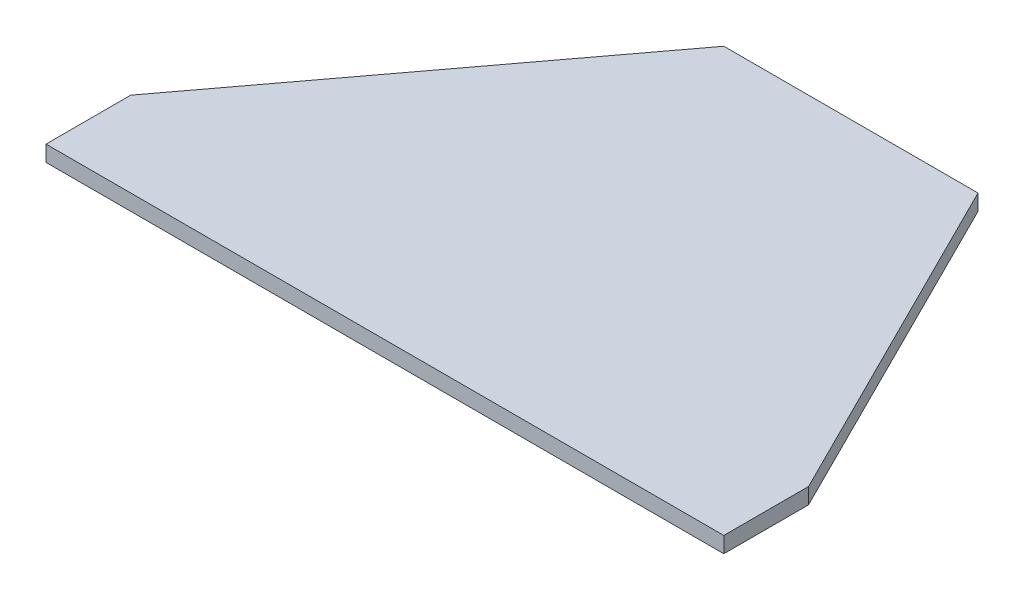
from build123d import *

# Parameters (mm, degrees)
BOSS_EXTRUDE1_DEPTH      = 2.38125
BOSS_EXTRUDE1_DEPTH_BACK = 2.38125


with BuildPart() as part:
    # Sketch1 → Boss-Extrude1 (new, two sides: drawn at the far end of the back side and taken through both)
    with BuildSketch(Plane(origin=(0, 0, 0), x_dir=(1, 0, 0), z_dir=(0, 1, 0)).offset(-BOSS_EXTRUDE1_DEPTH_BACK)):
        Polygon((0, 0), (0, 25.4), (76.2, 127), (152.4, 127), (203.2, 25.4), (203.2, 0), align=None)
    extrude(amount=BOSS_EXTRUDE1_DEPTH + BOSS_EXTRUDE1_DEPTH_BACK)


solid = part.part
